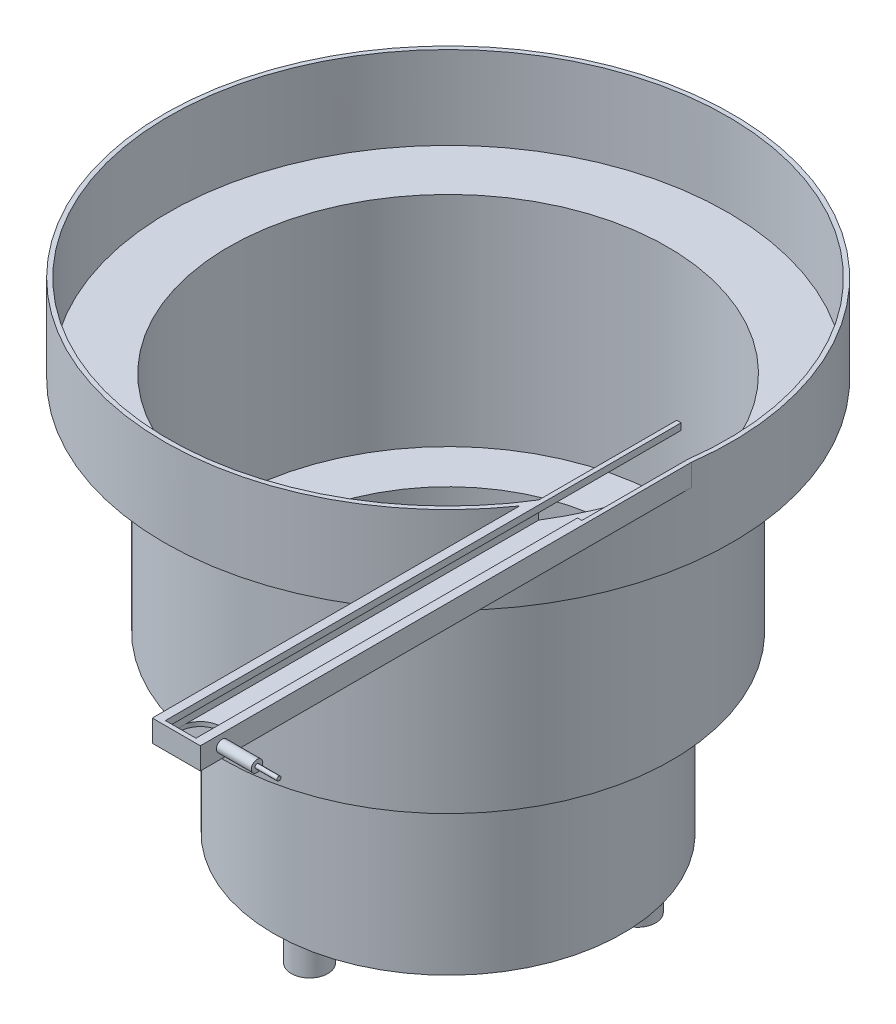
from build123d import *

# Parameters (mm, degrees)
SKETCH_3_R               = 80
EXTRUDE_1_DEPTH          = 80
SKETCH_4_R               = 102.5
EXTRUDE_2_DEPTH          = 100
SKETCH_5_R               = 130
EXTRUDE_3_DEPTH          = 40
SKETCH_6_W               = 22
SKETCH_6_H               = 240.840734586
EXTRUDE_4_DEPTH          = 10
SHELL_START              = 82
SHELL_1_OUTLINE_R        = 100.5
SHELL_1_DEPTH            = 138
SHELL_START_2            = 2
SHELL_1_2_OUTLINE_R      = 78
SHELL_1_2_DEPTH          = 80
SHELL_START_3            = 182
SHELL_1_3_OUTLINE_R      = 128
SHELL_1_3_OUTLINE_R_2    = 100.5
SHELL_1_3_DEPTH          = 38
SHELL_START_4            = 212
SHELL_1_4_DEPTH          = 8
SKETCH_7_R               = 8.399329468
EXTRUDE_5_DEPTH          = 20
PATTERN_CIRCULAR_1_COUNT = 3
SKETCH_9_W               = 22
SKETCH_9_H               = 2
CUT_EXTRUDE_1_DEPTH      = 365.969552782
SKETCH_10_W              = 2
SKETCH_10_H              = 236.138085802
SKETCH_10_H_2            = 174.695606664
EXTRUDE_6_DEPTH          = 3
SKETCH_11_W              = 22
SKETCH_11_H              = 10
EXTRUDE_7_DEPTH          = 2
SKETCH_12_R              = 9.35670837
CUT_EXTRUDE_2_DEPTH      = 360.759328521
SKETCH_13_R              = 2.613319885
EXTRUDE_8_DEPTH          = 16
SKETCH_14_R              = 0.941183601
EXTRUDE_9_DEPTH          = 10


# Read off the part's stored shape, not the designer's step: 抽壳1
with BuildPart() as part:
    # 草图3 → 凸台-拉伸1 (new body)
    with BuildSketch(Plane(origin=(0, 0, 0), x_dir=(1, 0, 0), z_dir=(0, 1, 0))):
        with Locations(Location((0, 0, 0), (0, 0, 270))):
            Circle(SKETCH_3_R)
    extrude(amount=EXTRUDE_1_DEPTH)

    # 草图4 → 凸台-拉伸2 (add)
    with BuildSketch(Plane(origin=(0, 80, 0), x_dir=(1, 0, 0), z_dir=(0, 1, 0))):
        with Locations(Location((0, 0, 0), (0, 0, 270))):
            Circle(SKETCH_4_R)
    extrude(amount=EXTRUDE_2_DEPTH)

    # 草图5 → 凸台-拉伸3 (add)
    with BuildSketch(Plane(origin=(0, 180, 0), x_dir=(1, 0, 0), z_dir=(0, 1, 0))):
        with Locations(Location((0, 0, 0), (0, 0, 270))):
            Circle(SKETCH_5_R)
    extrude(amount=EXTRUDE_3_DEPTH)

    # 草图6 → 凸台-拉伸4 (add)
    with BuildSketch(Plane(origin=(0, 220, 0), x_dir=(1, 0, 0), z_dir=(0, 1, 0))):
        with Locations((117.8420905, -121.866187138)):
            Rectangle(SKETCH_6_W, SKETCH_6_H)
    extrude(amount=-EXTRUDE_4_DEPTH)

    # 抽壳1 outline → 抽壳1 (cut)
    with BuildSketch(Plane(origin=(0, 0, 0), x_dir=(1, 0, 0), z_dir=(0, 1, 0)).offset(SHELL_START)):
        Circle(SHELL_1_OUTLINE_R)
    extrude(amount=SHELL_1_DEPTH, mode=Mode.SUBTRACT)

    # Shell 1 2 outline → Shell 1 2 (cut)
    with BuildSketch(Plane(origin=(0, 0, 0), x_dir=(1, 0, 0), z_dir=(0, 1, 0)).offset(SHELL_START_2)):
        Circle(SHELL_1_2_OUTLINE_R)
    extrude(amount=SHELL_1_2_DEPTH, mode=Mode.SUBTRACT)

    # Shell 1 3 outline → Shell 1 3 (cut)
    with BuildSketch(Plane(origin=(0, 0, 0), x_dir=(1, 0, 0), z_dir=(0, 1, 0)).offset(SHELL_START_3)):
        Circle(SHELL_1_3_OUTLINE_R)
        Circle(SHELL_1_3_OUTLINE_R_2, mode=Mode.SUBTRACT)
    extrude(amount=SHELL_1_3_DEPTH, mode=Mode.SUBTRACT)

    # Shell 1 4 outline → Shell 1 4 (cut)
    with BuildSketch(Plane(origin=(0, 0, 0), x_dir=(1, 0, 0), z_dir=(0, 1, 0)).offset(SHELL_START_4)):
        with BuildLine():
            ThreePointArc((126.8420905, -17.178011456), (120.483699417, -43.216642337), (108.8420905, -67.360220721))
            Line((108.8420905, -67.360220721), (108.8420905, -240.286554431))
            Line((108.8420905, -240.286554431), (126.8420905, -240.286554431))
            Line((126.8420905, -240.286554431), (126.8420905, -17.178011456))
        make_face()
    extrude(amount=SHELL_1_4_DEPTH, mode=Mode.SUBTRACT)

    # 草图7 → 凸台-拉伸5 (add)
    with BuildSketch(Plane.XZ):
        with Locations(Location((0, 63.429571018, 0), (0, 0, 90))):
            Circle(SKETCH_7_R)
    extrude_5 = extrude(amount=EXTRUDE_5_DEPTH)

    # 阵列(圆周)1: 凸台-拉伸5 ×3 about axis
    pattern_circular_1_axis = Axis((0, 0, 0), (0, 1, 0))
    for i in range(1, PATTERN_CIRCULAR_1_COUNT):
        add(extrude_5.rotate(pattern_circular_1_axis, i * 360 / PATTERN_CIRCULAR_1_COUNT))

    # 草图9 → 切除-拉伸1 (cut, through all)
    with BuildSketch(Plane(origin=(0, 220, 0), x_dir=(1, 0, 0), z_dir=(0, 1, 0))):
        with Locations((117.8420905, -241.286554431)):
            Rectangle(SKETCH_9_W, SKETCH_9_H)
    extrude(amount=-CUT_EXTRUDE_1_DEPTH, mode=Mode.SUBTRACT)

    # 草图10 → 凸台-拉伸6 (add)
    with BuildSketch(Plane(origin=(0, 220, 0), x_dir=(1, 0, 0), z_dir=(0, 1, 0))):
        with Locations((109.8420905, -122.21751153)):
            Rectangle(SKETCH_10_W, SKETCH_10_H)
        with Locations((125.8420905, -152.938751099)):
            Rectangle(SKETCH_10_W, SKETCH_10_H_2)
    extrude(amount=-EXTRUDE_6_DEPTH)

    # 草图11 → 凸台-拉伸7 (add)
    with BuildSketch(Plane.XY.offset(240.286554431)):
        with Locations((117.8420905, 215)):
            Rectangle(SKETCH_11_W, SKETCH_11_H)
    extrude(amount=EXTRUDE_7_DEPTH)

    # 草图12 → 切除-拉伸2 (cut, through all)
    with BuildSketch(Plane(origin=(0, 212, 0), x_dir=(1, 0, 0), z_dir=(0, 1, 0))):
        with Locations(Location((117.8420905, -231.286554431, 0), (0, 0, 254.128345291))):
            Circle(SKETCH_12_R)
    extrude(amount=-CUT_EXTRUDE_2_DEPTH, mode=Mode.SUBTRACT)

    # 草图13 → 凸台-拉伸8 (add)
    with BuildSketch(Plane(origin=(128.8420905, 0, 0), x_dir=(0, 0, -1), z_dir=(1, 0, 0))):
        with Locations((-232.319143826, 214.997371462)):
            Circle(SKETCH_13_R)
    extrude(amount=EXTRUDE_8_DEPTH)

    # 草图14 → 凸台-拉伸9 (add)
    with BuildSketch(Plane(origin=(144.8420905, 0, 0), x_dir=(0, 0, -1), z_dir=(1, 0, 0))):
        with Locations((-232.319143826, 214.997371462)):
            Circle(SKETCH_14_R)
    extrude(amount=EXTRUDE_9_DEPTH)


solid = part.part
